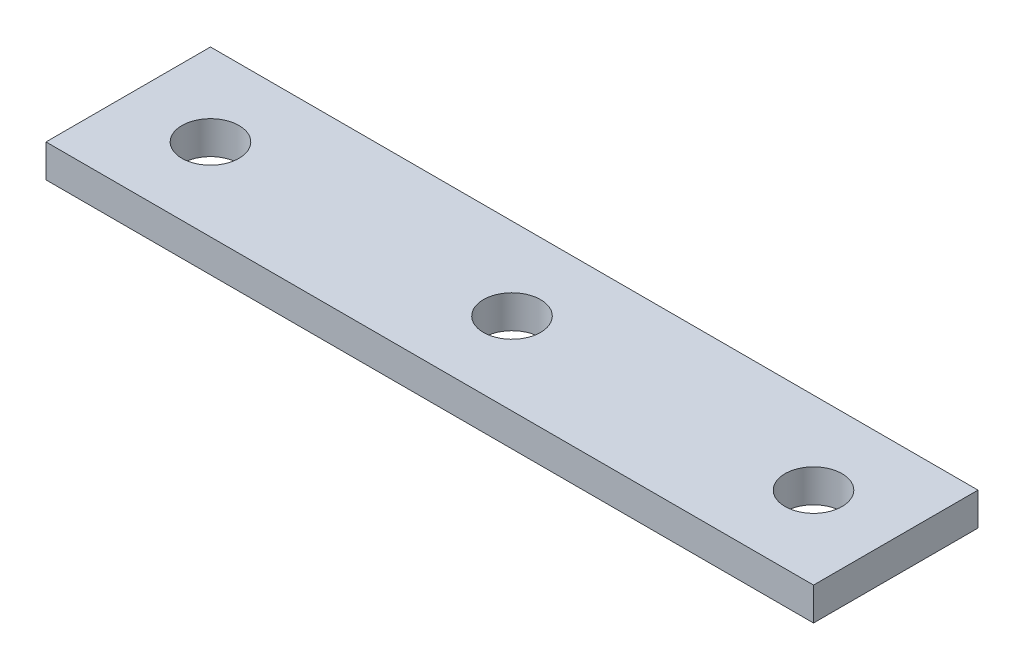
from build123d import *

# Parameters (mm, degrees)
SKETCH_1_W      = 70
SKETCH_1_H      = 15
SKETCH_1_R      = 2.6
EXTRUDE_1_DEPTH = 3


with BuildPart() as part:
    # Эскиз1 → Бобышка-Вытянуть1 (new body)
    with BuildSketch(Plane(origin=(0, 0, 0), x_dir=(1, 0, 0), z_dir=(0, 1, 0))):
        Rectangle(SKETCH_1_W, SKETCH_1_H)
        Circle(SKETCH_1_R, mode=Mode.SUBTRACT)
        with Locations((27.5, 0)):
            Circle(SKETCH_1_R, mode=Mode.SUBTRACT)
        with Locations((-27.5, 0)):
            Circle(SKETCH_1_R, mode=Mode.SUBTRACT)
    extrude(amount=EXTRUDE_1_DEPTH)


solid = part.part
